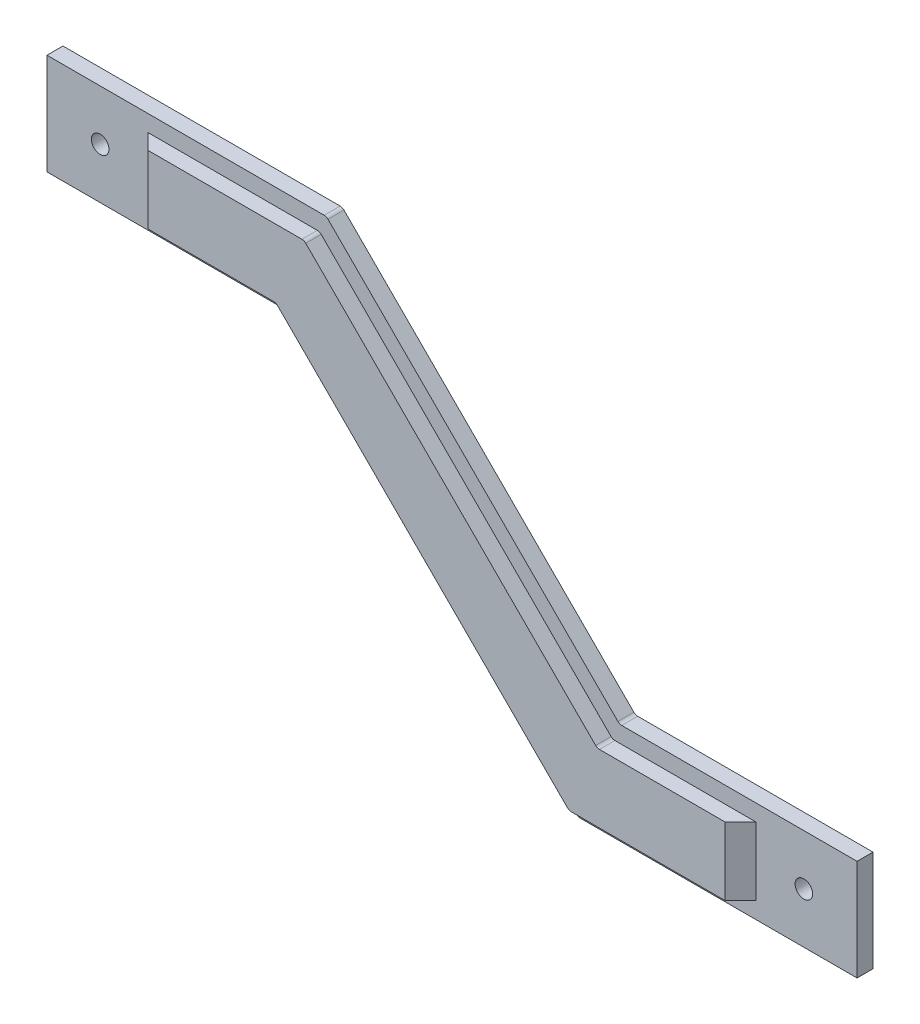
from build123d import *

# Parameters (mm, degrees)
SKETCH_1_R      = 1.65
EXTRUDE_1_DEPTH = 3
EXTRUDE_2_DEPTH = 2.9
CHAMFER_1_SIZE  = 2.9
FILLET_1_R      = 1


with BuildPart() as part:
    # 草图1 → 凸台-拉伸1 (new body)
    with BuildSketch(Plane.XY):
        Polygon((-76.15, 37.05), (-23.614971157, 37.05), (31.485028843, -18.05), (76.15, -18.05), (76.15, -37.05), (23.614971157, -37.05), (-31.485028843, 18.05), (-76.15, 18.05), align=None)
        with Locations((-66.15, 27.55)):
            Circle(SKETCH_1_R, mode=Mode.SUBTRACT)
        with Locations((66.15, -27.55)):
            Circle(SKETCH_1_R, mode=Mode.SUBTRACT)
    extrude(amount=EXTRUDE_1_DEPTH)

    # 草图2 → 凸台-拉伸2 (add)
    with BuildSketch(Plane.XY.offset(3)):
        Polygon((-57.15, 33.95), (-57.15, 21.15), (-30.200966799, 21.15), (24.899033201, -33.95), (57.15, -33.95), (57.15, -21.15), (30.200966799, -21.15), (-24.899033201, 33.95), align=None)
    extrude(amount=EXTRUDE_2_DEPTH)

    # 倒角1
    chamfer_1_edges = [part.edges().sort_by_distance(p)[0] for p in [
        (57.15, -27.55, 5.9),
        (-57.15, 27.55, 5.9),
    ]]
    chamfer(chamfer_1_edges, length=CHAMFER_1_SIZE - 0.0001)  # a hair under: the kernel refuses the full size

    # 圆角1
    fillet_1_edges = [part.edges().sort_by_distance(p)[0] for p in [
        (-23.614971157, 37.05, 1.5),
        (31.485028843, -18.05, 1.5),
        (23.614971157, -37.05, 1.5),
        (-31.485028843, 18.05, 1.5),
        (-24.899033201, 33.95, 4.45),
        (-30.200966799, 21.15, 4.45),
        (24.899033201, -33.95, 4.45),
        (30.200966799, -21.15, 4.45),
    ]]
    fillet(fillet_1_edges, radius=FILLET_1_R)


solid = part.part
